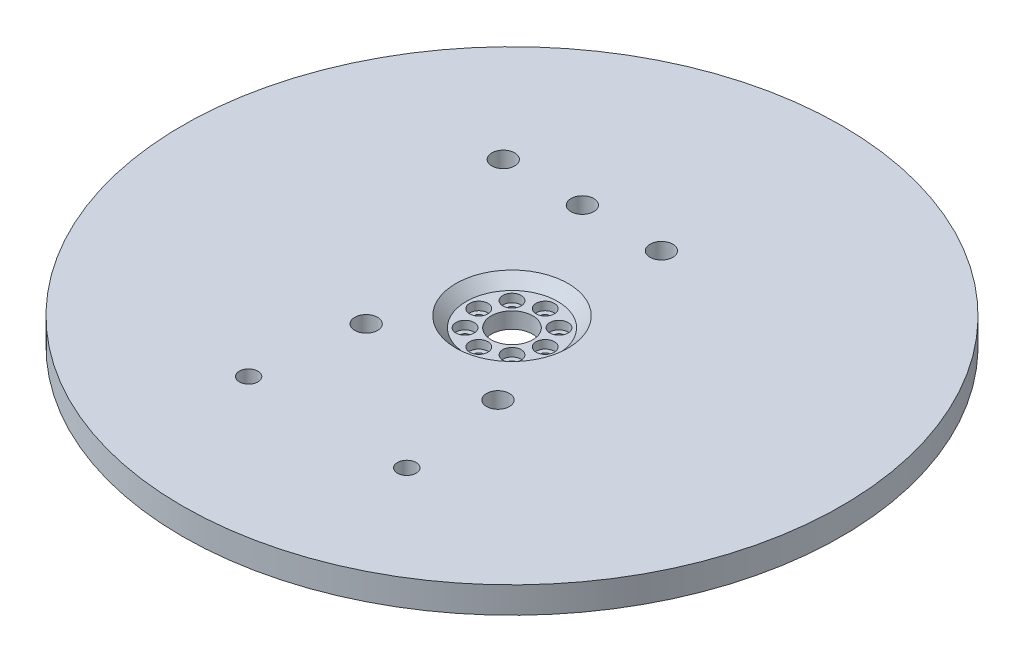
from build123d import *

# Parameters (mm, degrees)
SKETCH1_R                      = 79.375
BOSS_EXTRUDE1_DEPTH            = 3.175
SKETCH5_R                      = 11
CUT_EXTRUDE1_DEPTH             = 2.5
SKETCH6_R                      = 5
CUT_EXTRUDE2_DEPTH             = 113.432663181
CBORE_FOR_M2_SHCS1_D           = 2.2
CBORE_FOR_M2_SHCS1_DEPTH       = 6
CBORE_FOR_M2_SHCS1_CBORE_D     = 4.4
CBORE_FOR_M2_SHCS1_CBORE_DEPTH = 2
CBORE_FOR_M2_SHCS1_TIP         = 0.660946681
M4_CLEARANCE_HOLE1_D           = 4.5
M5_CLEARANCE_HOLE1_D           = 5.5
CHAMFER1_SIZE                  = 2.5


with BuildPart() as part:
    # Sketch1 → Boss-Extrude1 (new, symmetric)
    with BuildSketch(Plane(origin=(0, 0, 0), x_dir=(1, 0, 0), z_dir=(0, 1, 0))):
        with Locations(Location((0, 0, 0), (0, 0, 270))):
            Circle(SKETCH1_R)
    extrude(amount=BOSS_EXTRUDE1_DEPTH, both=True)

    # Sketch5 → Cut-Extrude1 (cut)
    with BuildSketch(Plane(origin=(0, 3.175, 0), x_dir=(1, 0, 0), z_dir=(0, 1, 0))):
        with Locations(Location((0, 0, 0), (0, 0, 270))):
            Circle(SKETCH5_R)
    extrude(amount=-CUT_EXTRUDE1_DEPTH, mode=Mode.SUBTRACT)

    # Sketch6 → Cut-Extrude2 (cut, through all)
    with BuildSketch(Plane(origin=(0, 3.175, 0), x_dir=(1, 0, 0), z_dir=(0, 1, 0))):
        with Locations(Location((0, 0, 0), (0, 0, 270))):
            Circle(SKETCH6_R)
    extrude(amount=-CUT_EXTRUDE2_DEPTH, mode=Mode.SUBTRACT)

    # CBORE for M2 SHCS1
    with Locations(Plane(origin=(0, 0.675, 0), x_dir=(1, 0, 0), z_dir=(0, 1, 0))):
        with Locations((-5.65685425, 5.65685425), (0, 8), (5.65685425, 5.65685425), (8, 0), (5.65685425, -5.65685425), (0, -8), (-5.65685425, -5.65685425), (-8, 0)):
            CounterBoreHole(CBORE_FOR_M2_SHCS1_D / 2, CBORE_FOR_M2_SHCS1_CBORE_D / 2, CBORE_FOR_M2_SHCS1_CBORE_DEPTH, depth=CBORE_FOR_M2_SHCS1_DEPTH)
            with Locations((0, 0, -(CBORE_FOR_M2_SHCS1_DEPTH + CBORE_FOR_M2_SHCS1_TIP / 2))):  # 118° drill point
                Cone(0, CBORE_FOR_M2_SHCS1_D / 2, CBORE_FOR_M2_SHCS1_TIP, mode=Mode.SUBTRACT)

    # M4 Clearance Hole1 (through all)
    with Locations(Plane(origin=(0, 3.175, 0), x_dir=(1, 0, 0), z_dir=(0, 1, 0))):
        with Locations((19.05, -44.388212048), (-19.05, -44.388212048)):
            Hole(M4_CLEARANCE_HOLE1_D / 2)

    # M5 Clearance Hole1 (through all)
    with Locations(Plane(origin=(0, 3.175, 0), x_dir=(1, 0, 0), z_dir=(0, 1, 0))):
        with Locations((-33.6688086, 31.567387952), (-14.6188086, 31.567387952), (4.4311914, 31.567387952), (-15.875, -19.249706448), (15.875, -19.249706448)):
            Hole(M5_CLEARANCE_HOLE1_D / 2)

    # Chamfer1
    chamfer1_edges = [part.edges().sort_by_distance(p)[0] for p in [
        (0, 3.175, -11),
    ]]
    chamfer(chamfer1_edges, length=CHAMFER1_SIZE - 0.0001)  # a hair under: the kernel refuses the full size


solid = part.part
